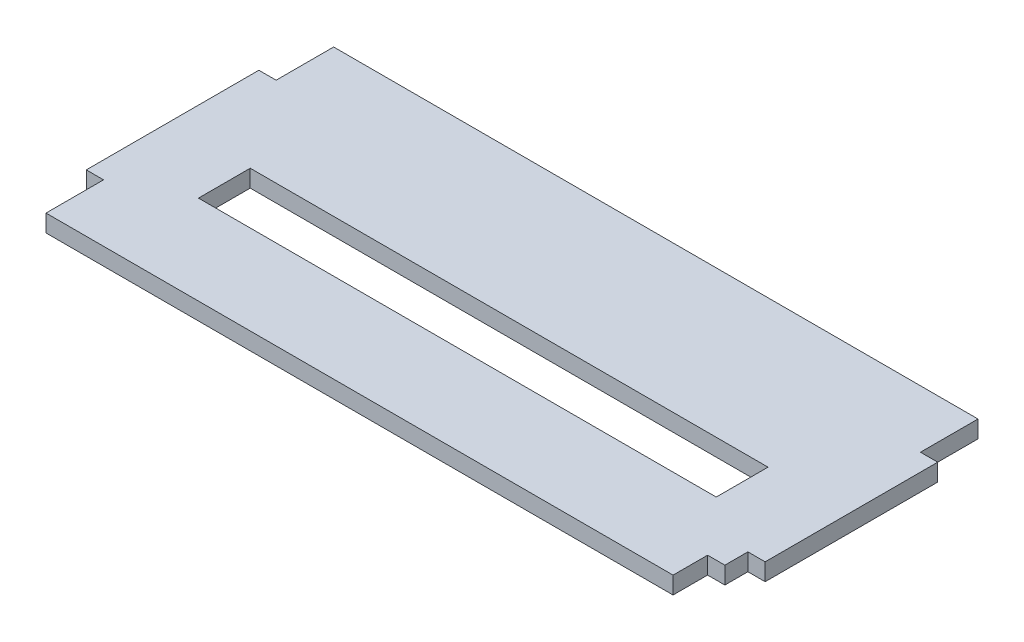
from build123d import *

# Parameters (mm, degrees)
LED_1_OUTLINE_R     = 2.25
LED_1_DEPTH         = 3
SKETCH_1_W          = 90
SKETCH_1_H          = 9
CUT_EXTRUDE_1_DEPTH = 3


# Read off the part's stored shape, not the designer's step: 基体零件-LED板-1
with BuildPart() as part:
    # 基体零件-LED板-1 outline → 基体零件-LED板-1 (new body)
    with BuildSketch(Plane(origin=(0, 0, 0), x_dir=(1, 0, 0), z_dir=(0, 1, 0))):
        Polygon((-3, -140), (0, -140), (0, -110), (-3, -110), (-3, -100), (-115, -100), (-115, -110), (-118, -110), (-118, -140), (-115, -140), (-115, -150), (-6.001970153, -150), (-6.001970153, -144), (-3, -144), align=None)
        with Locations((-90.5, -130)):
            Circle(LED_1_OUTLINE_R, mode=Mode.SUBTRACT)
        with Locations((-81.5, -130)):
            Circle(LED_1_OUTLINE_R, mode=Mode.SUBTRACT)
        with Locations((-72.5, -130)):
            Circle(LED_1_OUTLINE_R, mode=Mode.SUBTRACT)
        with Locations((-63.5, -130)):
            Circle(LED_1_OUTLINE_R, mode=Mode.SUBTRACT)
        with Locations((-54.5, -130)):
            Circle(LED_1_OUTLINE_R, mode=Mode.SUBTRACT)
        with Locations((-45.5, -130)):
            Circle(LED_1_OUTLINE_R, mode=Mode.SUBTRACT)
        with Locations((-36.5, -130)):
            Circle(LED_1_OUTLINE_R, mode=Mode.SUBTRACT)
        with Locations((-27.5, -130)):
            Circle(LED_1_OUTLINE_R, mode=Mode.SUBTRACT)
    extrude(amount=LED_1_DEPTH)

    # 草图1 → 切除-拉伸1 (cut)
    with BuildSketch(Plane(origin=(0, 3, 0), x_dir=(1, 0, 0), z_dir=(0, 1, 0))):
        with Locations((-59, -130)):
            Rectangle(SKETCH_1_W, SKETCH_1_H)
    extrude(amount=-CUT_EXTRUDE_1_DEPTH, mode=Mode.SUBTRACT)


solid = part.part
